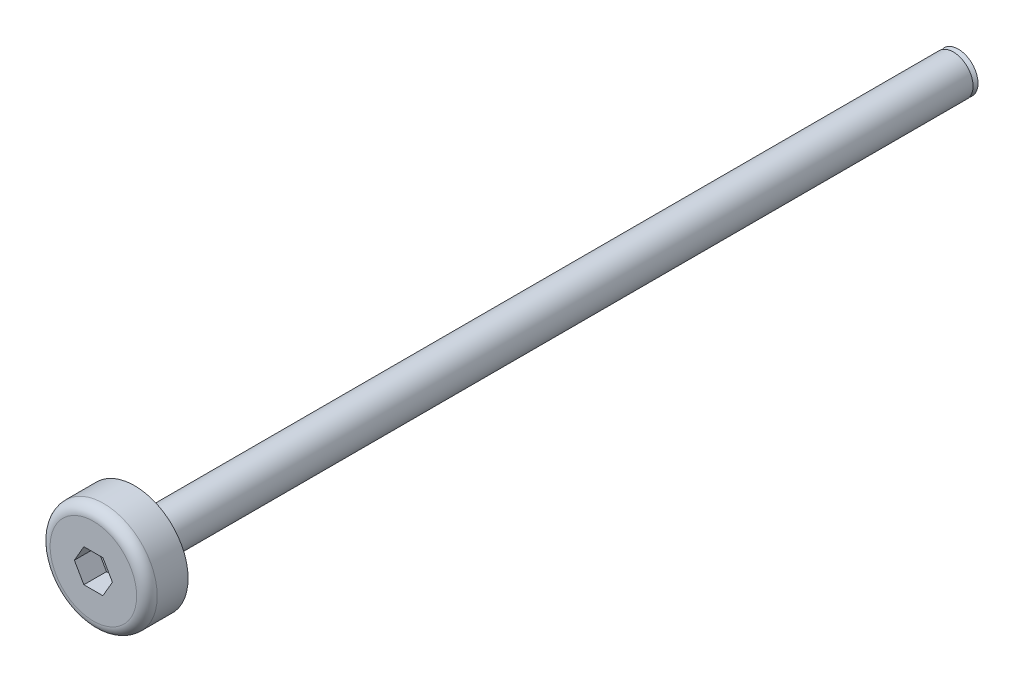
from build123d import *

# Parameters (mm, degrees)
F_0120_CYLINDER_SKETCH_R    = 3.25
F_0120_CYLINDER_DEPTH       = 2.5
F_0121_FILLET_R             = 0.625
F_0122_EXTRUDE_DEPTH        = 1.385
F_0122_EXTRUDE_ROTATE_ANGLE = 120
F_0125_CYLINDER_SKETCH_R    = 1.2
F_0125_CYLINDER_DEPTH       = 49.7
F_0126_CONE_ROTATE_ANGLE    = 90


with BuildPart() as part:
    # 0120_cylinder_Sketch → 0120_cylinder (new body)
    with BuildSketch(Plane.XY):
        Circle(F_0120_CYLINDER_SKETCH_R)
    extrude(amount=F_0120_CYLINDER_DEPTH)

    # 0121_fillet
    f_0121_fillet_edges = [part.edges().sort_by_distance(p)[0] for p in [
        (-3.25, 0, 2.5),
    ]]
    fillet(f_0121_fillet_edges, radius=F_0121_FILLET_R)


with BuildPart() as body_2:
    # 0122_extrude_Sketch → 0122_extrude (new body)
    with BuildSketch(Plane.XY):
        Polygon((0, 0), (1.154700538, 0), (1.732050808, 1), (1.154700538, 2), (0, 2), (-0.577350269, 1), align=None)
    extrude(amount=F_0122_EXTRUDE_DEPTH)


with BuildPart() as body_2_1:
    # 0122_extrude_Rotate: read off the stored shape, not the designer's step
    # 0122_extrude_Rotate: moved
    add(body_2.part.rotate(Axis((0, 0, 0), (0, 0, 1)), F_0122_EXTRUDE_ROTATE_ANGLE))


with BuildPart() as body_2_2:
    # 0122_extrude_Translate: moved
    add(body_2_1.part.moved(Location((1.154700538, 0, 1.125))))


with BuildPart() as part_1:
    add(part.part)

    # 0124_sub: cut body 2
    add(body_2_2.part, mode=Mode.SUBTRACT)


with BuildPart() as body_2_2_1:
    # 0125_cylinder_Sketch → 0125_cylinder (new body)
    with BuildSketch(Plane.XY):
        Circle(F_0125_CYLINDER_SKETCH_R)
    extrude(amount=F_0125_CYLINDER_DEPTH)


with BuildPart() as body_2_2_2:
    # 0125_cylinder_Translate: moved
    add(body_2_2_1.part.moved(Location((0, 0, -49.7))))


with BuildPart() as body_3:
    # 0126_cone_Sketch → 0126_cone (revolve)
    with BuildSketch(Plane.XY, mode=Mode.PRIVATE) as f_0126_cone_sk:
        Polygon((0, 0), (1.2, 0), (0.9, 0.3), (0, 0.3), align=None)
    revolve(f_0126_cone_sk.sketch.rotate(Axis((0, -100, 0), (0, 1, 0)), 90), axis=Axis((0, -100, 0), (0, 1, 0)))


with BuildPart() as body_3_1:
    # 0126_cone_Rotate: moved
    add(body_3.part.rotate(Axis((0, 0, 0), (1, 0, 0)), F_0126_CONE_ROTATE_ANGLE))


with BuildPart() as body_3_2:
    # 0126_cone_Translate: moved
    add(body_3_1.part.moved(Location((0, 0, -50))))


with BuildPart() as body_2_2_3:
    add(body_2_2_2.part)

    # 0128_add: union body 3
    add(body_3_2.part)


with BuildPart() as part_2:
    add(part_1.part)

    # 0129_add: union body 2 2
    add(body_2_2_3.part)


solid = part_2.part
